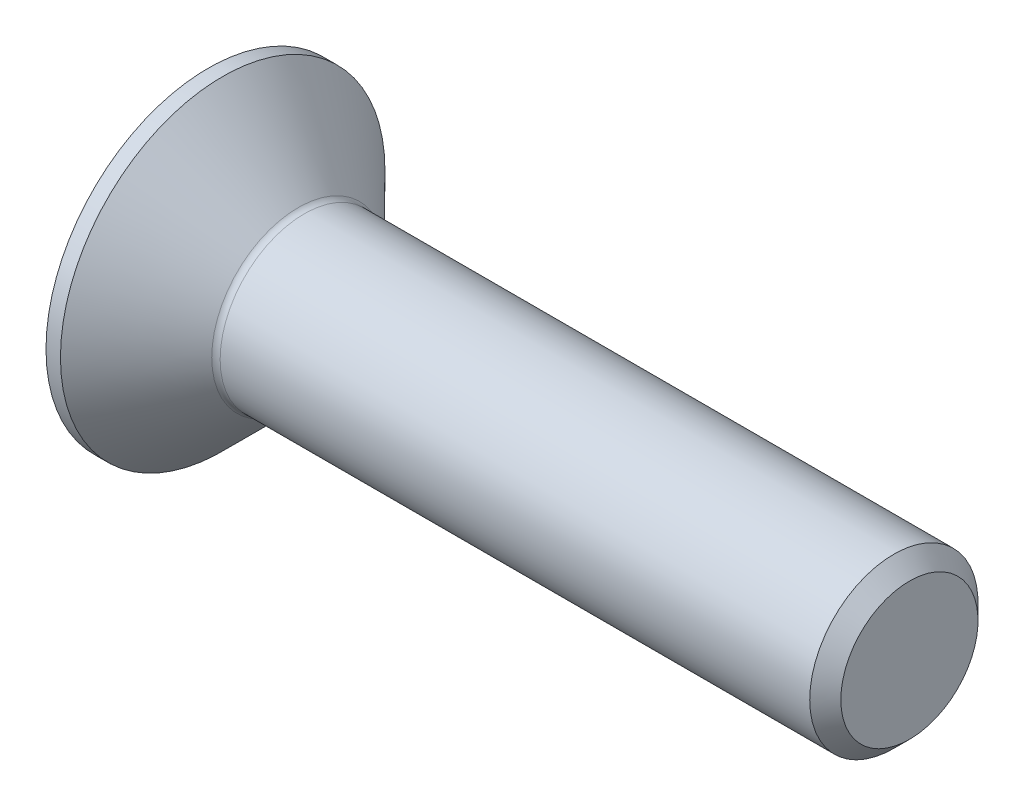
from build123d import *

# Parameters (mm, degrees)
FILLET1_R   = 0.3
HEX_START   = -2.5
HEX_2_DEPTH = 2.5


with BuildPart() as part:
    # BodySke → BaseBody (revolve)
    with BuildSketch(Plane.XY, mode=Mode.PRIVATE) as basebody_sk:
        Polygon((0, 0), (0, 5.785), (0.515, 5.785), (3.3, 3), (24.4455, 3), (25, 2.4455), (25, 0), align=None)
    revolve(basebody_sk.sketch.rotate(Axis((0, 0, 0), (1, 0, 0)), 90), axis=Axis((0, 0, 0), (1, 0, 0)))

    # Fillet1
    fillet1_edges = [part.edges().sort_by_distance(p)[0] for p in [
        (3.3, 0, -3),
    ]]
    fillet(fillet1_edges, radius=FILLET1_R)

    # Hex 2: read off the stored shape, not the designer's step
    # Hex 2 outline → Hex 2 (cut)
    with BuildSketch(Plane.ZY.offset(HEX_START)):
        Polygon((-2.01, -1.160474041), (0, -2.320948082), (2.01, -1.160474041), (2.01, 1.160474041), (0, 2.320948082), (-2.01, 1.160474041), align=None)
    extrude(amount=HEX_2_DEPTH, mode=Mode.SUBTRACT)

    # Hex 2 2 outline → Hex 2 2 (revolve, cut)
    with BuildSketch(Plane.YX):
        Polygon((2.01, 2.5), (0, 3.660474041), (0, 2.5), align=None)
    revolve(axis=Axis((0, 0, 0), (1, 0, 0)), mode=Mode.SUBTRACT)


solid = part.part
